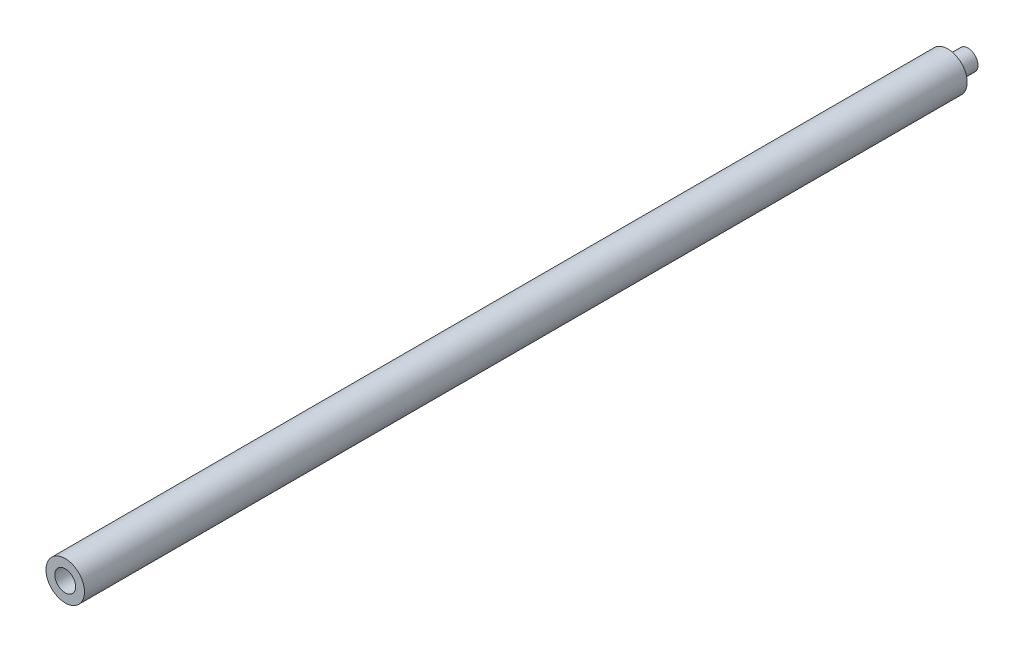
from build123d import *

# Parameters (mm, degrees)
SKETCH1_R           = 2.4
BOSS_EXTRUDE1_DEPTH = 110
SKETCH6_R           = 1.25
BOSS_EXTRUDE2_DEPTH = 2.5
SKETCH7_R           = 1.3
CUT_EXTRUDE1_DEPTH  = 2.5


with BuildPart() as part:
    # Sketch1 → Boss-Extrude1 (new body)
    with BuildSketch(Plane.XY):
        Circle(SKETCH1_R)
    extrude(amount=BOSS_EXTRUDE1_DEPTH)

    # Sketch6 → Boss-Extrude2 (add)
    with BuildSketch(Plane(origin=(0, 0, 0), x_dir=(-1, 0, 0), z_dir=(0, 0, -1))):
        Circle(SKETCH6_R)
    extrude(amount=BOSS_EXTRUDE2_DEPTH)

    # Sketch7 → Cut-Extrude1 (cut)
    with BuildSketch(Plane.XY.offset(110)):
        Circle(SKETCH7_R)
    extrude(amount=-CUT_EXTRUDE1_DEPTH, mode=Mode.SUBTRACT)


solid = part.part
